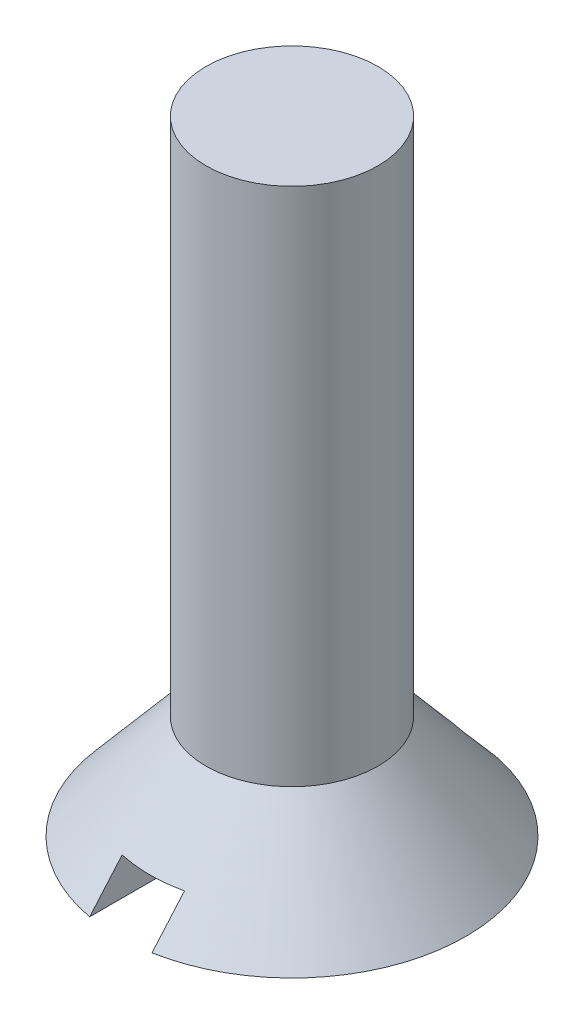
from build123d import *

# Parameters (mm, degrees)
SKETCH3_R               = 1.7526
BOSS_EXTRUDE1_DEPTH     = 10.5918
CUT_EXTRUDE1_DEPTH      = 4.1148
CUT_EXTRUDE1_DEPTH_BACK = 4.572


with BuildPart() as part:
    # Sketch2 → Revolve2 (revolve)
    with BuildSketch(Plane.XY):
        Polygon((3.5433, 0), (0, 0), (0, 2.1082), (1.7526, 2.1082), align=None)
    revolve(axis=Axis((0, 2.1082, 0), (0, -1, 0)))

    # Sketch3 → Boss-Extrude1 (add)
    with BuildSketch(Plane(origin=(0, 2.1082, 0), x_dir=(-1, 0, 0), z_dir=(0, 1, 0))):
        Circle(SKETCH3_R)
    extrude(amount=BOSS_EXTRUDE1_DEPTH)

    # Sketch4 → Cut-Extrude1 (cut, two sides: drawn at the far end of the back side and taken through both)
    with BuildSketch(Plane.XY.offset(-CUT_EXTRUDE1_DEPTH_BACK)):
        Polygon((0, 0), (0.635, 0), (0.635, 0.762), (0.123756422, 0.762), (-0.635, 0.762), (-0.635, 0), align=None)
    extrude(amount=CUT_EXTRUDE1_DEPTH + CUT_EXTRUDE1_DEPTH_BACK, mode=Mode.SUBTRACT)


solid = part.part
